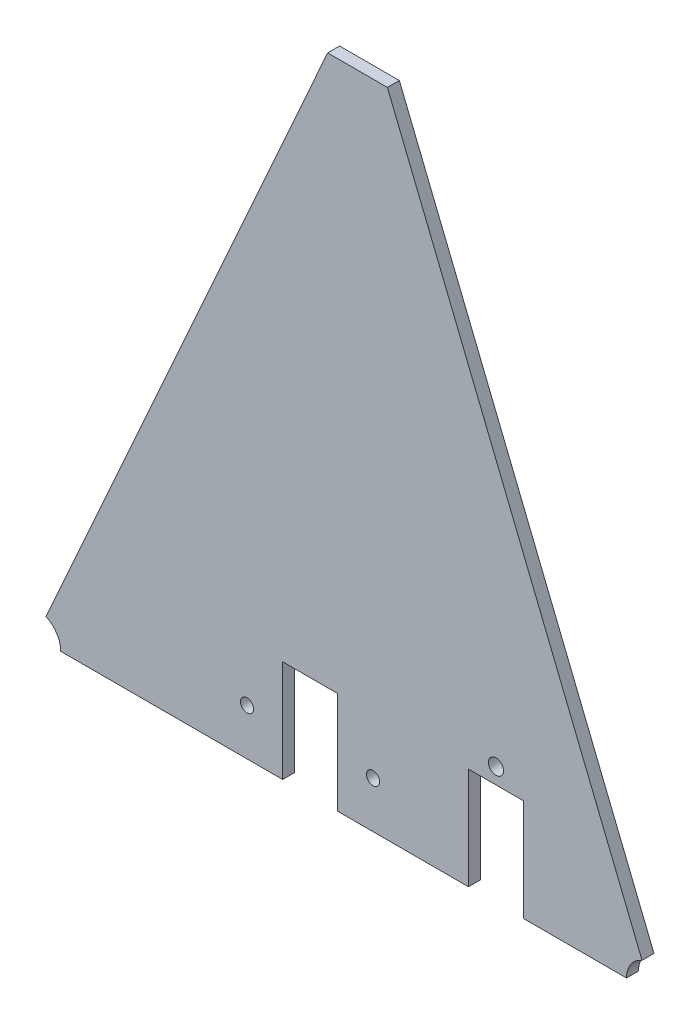
from build123d import *

# Parameters (mm, degrees)
BOSS_EXTRUDE1_DEPTH     = 7.62
SKETCH5_R               = 15.875
CUT_EXTRUDE2_DEPTH      = 50.8
SKETCH6_R               = 15.875
CUT_EXTRUDE3_DEPTH      = 50.8
CUT_EXTRUDE4_DEPTH      = 444.557362906
CUT_EXTRUDE4_DEPTH_BACK = 7.62
CUT_EXTRUDE6_REACH      = 445.557
SKETCH9_R               = 4.191
SKETCH10_W              = 35.052
SKETCH10_H              = 65.024
CUT_EXTRUDE12_DEPTH     = 25.4
CUT_EXTRUDE13_REACH     = 445.557
SKETCH13_R              = 4.826


with BuildPart() as part:
    # Sketch2 → Boss-Extrude1 (new body)
    with BuildSketch(Plane.XY):
        Polygon((-189.740054039, 245.383385713), (-375.90852523, -170.414614287), (16.77547477, -170.414614287), (-151.640054039, 245.383385713), align=None)
    extrude(amount=BOSS_EXTRUDE1_DEPTH)

    # Sketch5 → Cut-Extrude2 (cut)
    with BuildSketch(Plane(origin=(0, 0, 0), x_dir=(-1, 0, 0), z_dir=(0, 0, -1))):
        with Locations((375.90852523, -170.414614287)):
            Circle(SKETCH5_R)
    extrude(amount=-CUT_EXTRUDE2_DEPTH, mode=Mode.SUBTRACT)

    # Sketch6 → Cut-Extrude3 (cut)
    with BuildSketch(Plane(origin=(0, 0, 0), x_dir=(-1, 0, 0), z_dir=(0, 0, -1))):
        with Locations((-16.77547477, -170.414614287)):
            Circle(SKETCH6_R)
    extrude(amount=-CUT_EXTRUDE3_DEPTH, mode=Mode.SUBTRACT)

    # Sketch8 → Cut-Extrude4 (cut, two sides: drawn at the far end of the back side and taken through both)
    with BuildSketch(Plane(origin=(0, 0, 0), x_dir=(-1, 0, 0), z_dir=(0, 0, -1)).offset(-CUT_EXTRUDE4_DEPTH_BACK)):
        Polygon((218.448947474, -1130.046710402), (218.448947474, -170.414614287), (218.448947474, -105.390614287), (183.523947474, -105.390614287), (183.523947474, -170.414614287), (183.523947474, -1130.046710402), (183.523947474, -3049.310902633), (218.448947474, -3049.310902633), align=None)
    extrude(amount=CUT_EXTRUDE4_DEPTH + CUT_EXTRUDE4_DEPTH_BACK, mode=Mode.SUBTRACT)

    # Sketch9 → Cut-Extrude6 (cut, up to next)
    with BuildSketch(Plane(origin=(0, 0, 0), x_dir=(-1, 0, 0), z_dir=(0, 0, -1)), mode=Mode.PRIVATE) as cut_extrude6_sk1:
        with Locations((160.790947474, -140.823614287)):
            Circle(SKETCH9_R)
    cut_extrude6_tool1 = extrude(cut_extrude6_sk1.sketch, amount=-CUT_EXTRUDE6_REACH, mode=Mode.PRIVATE) & part.part
    # Sketch9 → Cut-Extrude6 (cut, up to next)
    with BuildSketch(Plane(origin=(0, 0, 0), x_dir=(-1, 0, 0), z_dir=(0, 0, -1)), mode=Mode.PRIVATE) as cut_extrude6_sk2:
        with Locations((241.181947474, -140.823614287)):
            Circle(SKETCH9_R)
    cut_extrude6_tool2 = extrude(cut_extrude6_sk2.sketch, amount=-CUT_EXTRUDE6_REACH, mode=Mode.PRIVATE) & part.part
    add(cut_extrude6_tool1.solids().sort_by_distance((-160.790947, -140.823614, 0))[0], mode=Mode.SUBTRACT)
    add(cut_extrude6_tool2.solids().sort_by_distance((-241.181947, -140.823614, 0))[0], mode=Mode.SUBTRACT)

    # Sketch10 → Cut-Extrude12 (cut)
    with BuildSketch(Plane(origin=(0, 0, 0), x_dir=(-1, 0, 0), z_dir=(0, 0, -1))):
        with Locations((82.352257047, -137.902614287)):
            Rectangle(SKETCH10_W, SKETCH10_H)
    extrude(amount=-CUT_EXTRUDE12_DEPTH, mode=Mode.SUBTRACT)

    # Sketch13 → Cut-Extrude13 (cut, up to next)
    with BuildSketch(Plane(origin=(0, 0, 0), x_dir=(-1, 0, 0), z_dir=(0, 0, -1)), mode=Mode.PRIVATE) as cut_extrude13_sk1:
        with Locations((82.352257047, -95.230614287)):
            Circle(SKETCH13_R)
    cut_extrude13_tool1 = extrude(cut_extrude13_sk1.sketch, amount=-CUT_EXTRUDE13_REACH, mode=Mode.PRIVATE) & part.part
    add(cut_extrude13_tool1.solids().sort_by_distance((-82.352257, -95.230614, 0))[0], mode=Mode.SUBTRACT)


solid = part.part
